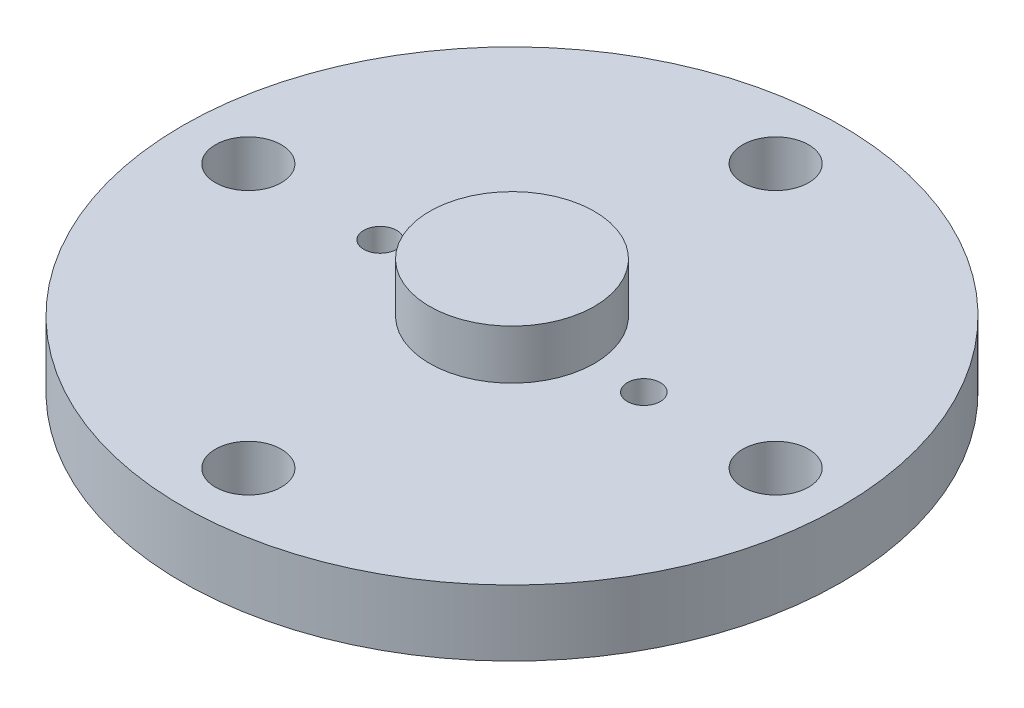
from build123d import *

# Parameters (mm, degrees)
REVOLVE_1_OUTLINE_R   = 10
REVOLVE_1_DEPTH       = 2
REVOLVE_START         = 2
REVOLVE_1_2_OUTLINE_R = 2.5
REVOLVE_1_2_DEPTH     = 1.5
SKETCH_2_R            = 1
SKETCH_2_R_2          = 0.5
CUT_EXTRUDE_2_DEPTH   = 15.282856857


# Read off the part's stored shape, not the designer's step: 旋转1
with BuildPart() as part:
    # 旋转1 outline → 旋转1 (new body)
    with BuildSketch(Plane(origin=(0, 0, 0), x_dir=(1, 0, 0), z_dir=(0, 1, 0))):
        Circle(REVOLVE_1_OUTLINE_R)
    extrude(amount=REVOLVE_1_DEPTH)

    # Revolve 1 2 outline → Revolve 1 2 (add)
    with BuildSketch(Plane(origin=(0, 0, 0), x_dir=(1, 0, 0), z_dir=(0, 1, 0)).offset(REVOLVE_START)):
        Circle(REVOLVE_1_2_OUTLINE_R)
    extrude(amount=REVOLVE_1_2_DEPTH)

    # 草图2 → 切除-拉伸2 (cut, through all)
    with BuildSketch(Plane(origin=(0, 2, 0), x_dir=(1, 0, 0), z_dir=(0, 1, 0))):
        with Locations(Location((-8, 0, 0), (0, 0, 180))):
            Circle(SKETCH_2_R)
        with Locations((4, 0)):
            Circle(SKETCH_2_R_2)
        with Locations((8, 0)):
            Circle(SKETCH_2_R)
        with Locations(Location((-4, 0, 0), (0, 0, 180))):
            Circle(SKETCH_2_R_2)
        with Locations(Location((0, 8, 0), (0, 0, 180))):
            Circle(SKETCH_2_R)
        with Locations((0, -8)):
            Circle(SKETCH_2_R)
    extrude(amount=-CUT_EXTRUDE_2_DEPTH, mode=Mode.SUBTRACT)


solid = part.part
